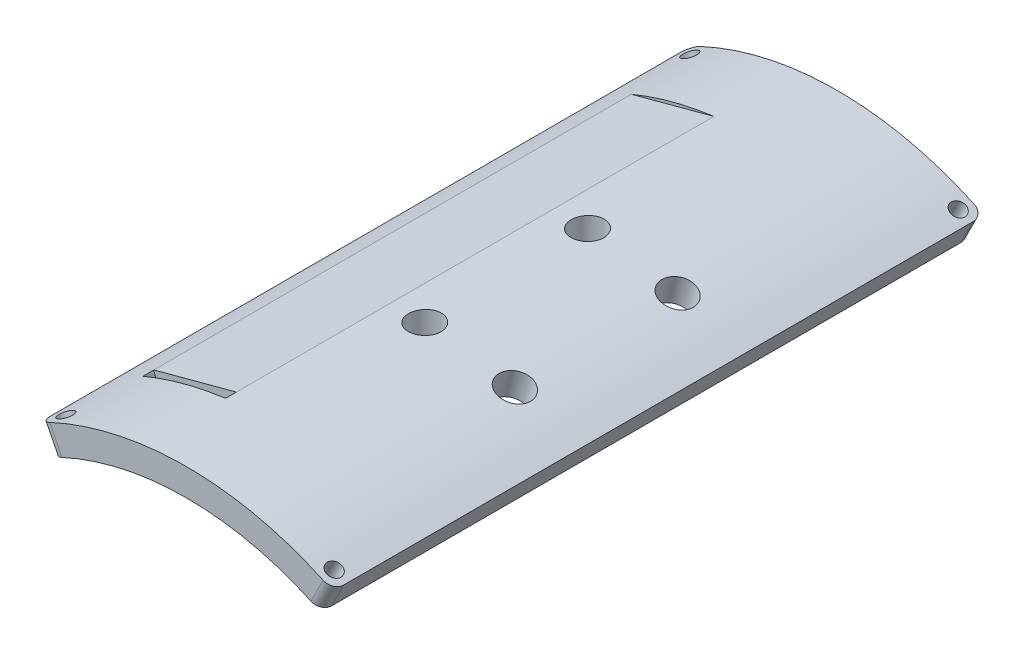
from build123d import *

# Parameters (mm, degrees)
BOSS_EXTRUDE1_DEPTH   = 152.4
SKETCH3_R             = 1.7526
CUT_EXTRUDE1_DEPTH    = 168.305252558
FILLET1_R             = 2.54
CRVPATTERN1_START     = -76.199999859
CRVPATTERN1_OUTLINE_R = 3.81
CRVPATTERN1_DEPTH     = 6.516085806
CRVPATTERN2_COUNT     = 2
CRVPATTERN2_PITCH     = 38.1
CUT_EXTRUDE2_DEPTH    = 2.54
CUT_EXTRUDE3_DEPTH    = 114.3


# Read off the part's stored shape, not the designer's step: CrvPattern1
with BuildPart() as part:
    # Sketch1 → Boss-Extrude1 (new body)
    with BuildSketch(Plane.XY):
        with BuildLine():
            Line((-31.4183141, 62.385190864), (-34.274524473, 68.056571851))
            ThreePointArc((-34.274524473, 68.056571851), (0, 76.2), (34.274524473, 68.056571851))
            Line((34.274524473, 68.056571851), (31.4183141, 62.385190864))
            ThreePointArc((31.4183141, 62.385190864), (0, 69.85), (-31.4183141, 62.385190864))
        make_face()
    extrude(amount=BOSS_EXTRUDE1_DEPTH)

    # Sketch3 → Cut-Extrude1 (cut, through all)
    with BuildSketch(Plane(origin=(-34.274524473, 68.056571851, 0), x_dir=(0.8931308641919528, 0.44979690909090914, 0), z_dir=(-0.44979690909090914, 0.8931308641919528, 0))):
        with Locations(Location((3.175, -3.175, 0), (0, 0, 180))):
            Circle(SKETCH3_R)
        with Locations(Location((3.175, -149.225, 0), (0, 0, 180))):
            Circle(SKETCH3_R)
    cut_extrude1 = extrude(amount=-CUT_EXTRUDE1_DEPTH, mode=Mode.SUBTRACT)

    # Mirror1: Cut-Extrude1 across plane
    add(cut_extrude1.mirror(Plane(origin=(0, 0, 0), x_dir=(0, 0, 1), z_dir=(1, 0, 0))), mode=Mode.SUBTRACT)

    # Fillet1
    fillet1_edges = [part.edges().sort_by_distance(p)[0] for p in [
        (32.846419286, 65.220881358, 152.4),
        (32.846419286, 65.220881358, 0),
        (-32.846419286, 65.220881358, 0),
        (-32.846419286, 65.220881358, 152.4),
    ]]
    fillet(fillet1_edges, radius=FILLET1_R)

    # Sketch4 → Cut-Revolve1 (revolve, cut)
    with BuildSketch(Plane(origin=(0, 0, 95.25), x_dir=(-1, 0, 0), z_dir=(0, 0, -1))):
        Polygon((-19.722011237, 73.603547963), (-16.041833839, 74.589648525), (-14.069632715, 67.229293729), (-17.749810113, 66.243193167), align=None)
    cut_revolve1 = revolve(axis=Axis((18.0785103, 67.469918966, 95.25), (-0.2588190451025146, -0.96592582628907, 1.788118686762064e-15)), mode=Mode.SUBTRACT)

    # CrvPattern1 outline → CrvPattern1 (cut)
    with BuildSketch(Plane(origin=(0, 0, 0), x_dir=(0.9999881548215976, 0.0048672596495795695, 0), z_dir=(0.0048672596495795695, -0.9999881548215978, 0)).offset(CRVPATTERN1_START)):
        with Locations((-1.00400126, 95.25)):
            Circle(CRVPATTERN1_OUTLINE_R)
    crvpattern1 = extrude(amount=CRVPATTERN1_DEPTH, mode=Mode.SUBTRACT)

    # CrvPattern2: Cut-Revolve1, CrvPattern1 ×2
    with Locations(*[(0, 0, -i * CRVPATTERN2_PITCH) for i in range(1, CRVPATTERN2_COUNT)]):
        add(cut_revolve1, mode=Mode.SUBTRACT)
        add(crvpattern1, mode=Mode.SUBTRACT)

    # Sketch5 → Cut-Extrude2 (cut)
    with BuildSketch(Plane.XY.offset(133.35)):
        Polygon((-17.396820803, 64.925819127), (-7.73756254, 67.514009578), (-10.393637902, 77.426617779), (-29.712154428, 72.250236877), (-27.056079066, 62.337628676), align=None)
    extrude(amount=-CUT_EXTRUDE2_DEPTH, mode=Mode.SUBTRACT)

    # Sketch7 → Cut-Extrude3 (cut)
    with BuildSketch(Plane.XY.offset(133.35)):
        Polygon((-29.737073932, 72.343237731), (-10.418557406, 77.519618633), (-9.89218663, 75.555176154), (-29.210703156, 70.378795252), align=None)
    extrude(amount=-CUT_EXTRUDE3_DEPTH, mode=Mode.SUBTRACT)


solid = part.part
